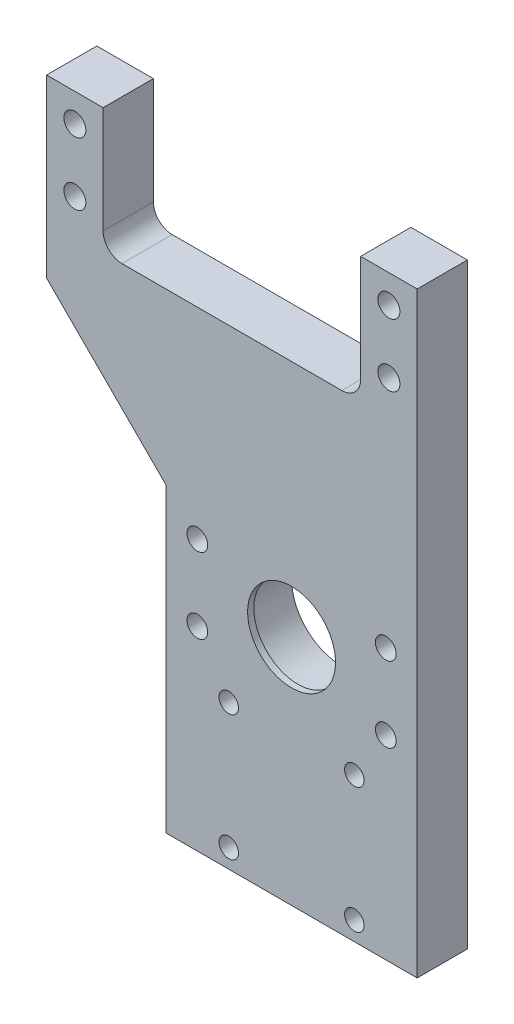
from build123d import *

# Parameters (mm, degrees)
ESQUISSE1_W             = 40
ESQUISSE1_H             = 30
BOSS_EXTRU_1_DEPTH      = 8
ENL_V_START             = -8
ESQUISSE2_R             = 8
ENL_V_MAT_EXTRU_1_DEPTH = 7
ESQUISSE3_W             = 40
ESQUISSE3_H             = 22
BOSS_EXTRU_2_DEPTH      = 8
ESQUISSE4_R             = 1.55
ENL_V_MAT_EXTRU_2_DEPTH = 8
ESQUISSE5_W             = 40
ESQUISSE5_H             = 43
BOSS_EXTRU_3_DEPTH      = 8
ESQUISSE6_W             = 31
ESQUISSE6_H             = 20
ENL_V_MAT_EXTRU_3_DEPTH = 8
BOSS_EXTRU_4_DEPTH      = 8
ESQUISSE8_R             = 1.75
ENL_V_MAT_EXTRU_4_DEPTH = 84.624159189
ESQUISSE9_R             = 7
ENL_V_MAT_EXTRU_5_DEPTH = 84.534424042
ESQUISSE10_R            = 1.65
ENL_V_MAT_EXTRU_6_DEPTH = 10
ESQUISSE11_R            = 1.65
ENL_V_MAT_EXTRU_7_DEPTH = 84.624159189
CHANFREIN1_SIZE         = 19
CONG_1_R                = 3


with BuildPart() as part:
    # Esquisse1 → Boss.-Extru.1 (new body)
    with BuildSketch(Plane.XY):
        with Locations((20, 15)):
            Rectangle(ESQUISSE1_W, ESQUISSE1_H)
    extrude(amount=BOSS_EXTRU_1_DEPTH)

    # Esquisse2 → Enlèv. mat.-Extru.1 (cut)
    with BuildSketch(Plane.XY.offset(8).offset(ENL_V_START)):
        with Locations((20, 15)):
            Circle(ESQUISSE2_R)
    extrude(amount=ENL_V_MAT_EXTRU_1_DEPTH, mode=Mode.SUBTRACT)

    # Esquisse3 → Boss.-Extru.2 (add)
    with BuildSketch(Plane.XY.offset(8)):
        with Locations((20, -11)):
            Rectangle(ESQUISSE3_W, ESQUISSE3_H)
    extrude(amount=-BOSS_EXTRU_2_DEPTH)

    # Esquisse4 → Enlèv. mat.-Extru.2 (cut)
    with BuildSketch(Plane.XY.offset(8).offset(ENL_V_START)):
        with Locations((30, -19)):
            Circle(ESQUISSE4_R)
        with Locations(Location((30, 1, 0), (0, 0, 180))):
            Circle(ESQUISSE4_R)
        with Locations((10, 1)):
            Circle(ESQUISSE4_R)
        with Locations(Location((10, -19, 0), (0, 0, 180))):
            Circle(ESQUISSE4_R)
    extrude(amount=ENL_V_MAT_EXTRU_2_DEPTH, mode=Mode.SUBTRACT)

    # Esquisse5 → Boss.-Extru.3 (add)
    with BuildSketch(Plane.XY.offset(8)):
        with Locations((20, 51.5)):
            Rectangle(ESQUISSE5_W, ESQUISSE5_H)
    extrude(amount=-BOSS_EXTRU_3_DEPTH)

    # Esquisse6 → Enlèv. mat.-Extru.3 (cut)
    with BuildSketch(Plane.XY.offset(8).offset(ENL_V_START)):
        with Locations((15.5, 63)):
            Rectangle(ESQUISSE6_W, ESQUISSE6_H)
    extrude(amount=ENL_V_MAT_EXTRU_3_DEPTH, mode=Mode.SUBTRACT)

    # Esquisse7 → Boss.-Extru.4 (add)
    with BuildSketch(Plane.XY.offset(8)):
        Polygon((0, 53), (-10, 53), (-10, 73), (-19, 73), (-19, 45), (0, 45), align=None)
    extrude(amount=-BOSS_EXTRU_4_DEPTH)

    # Esquisse8 → Enlèv. mat.-Extru.4 (cut, through all)
    with BuildSketch(Plane.XY.offset(8)):
        with Locations((35.5, 58.5)):
            Circle(ESQUISSE8_R)
        with Locations(Location((35.5, 68.5, 0), (0, 0, 180))):
            Circle(ESQUISSE8_R)
        with Locations((-14.5, 68.5)):
            Circle(ESQUISSE8_R)
        with Locations(Location((-14.5, 58.5, 0), (0, 0, 180))):
            Circle(ESQUISSE8_R)
    extrude(amount=-ENL_V_MAT_EXTRU_4_DEPTH, mode=Mode.SUBTRACT)

    # Esquisse9 → Enlèv. mat.-Extru.5 (cut, through all)
    with BuildSketch(Plane(origin=(0, 0, 7), x_dir=(-1, 0, 0), z_dir=(0, 0, -1))):
        with Locations((-20, 15)):
            Circle(ESQUISSE9_R)
    extrude(amount=-ENL_V_MAT_EXTRU_5_DEPTH, mode=Mode.SUBTRACT)

    # Esquisse10 → Enlèv. mat.-Extru.6 (cut)
    with BuildSketch(Plane(origin=(0, -22, 0), x_dir=(-1, 0, 0), z_dir=(0, -1, 0))):
        with Locations(Location((-20, -4, 0), (0, 0, 90))):
            Circle(ESQUISSE10_R)
        with Locations(Location((-36, -4, 0), (0, 0, 90))):
            Circle(ESQUISSE10_R)
    extrude(amount=-ENL_V_MAT_EXTRU_6_DEPTH, mode=Mode.SUBTRACT)

    # Esquisse11 → Enlèv. mat.-Extru.7 (cut, through all)
    with BuildSketch(Plane(origin=(0, 0, 0), x_dir=(-1, 0, 0), z_dir=(0, 0, -1))):
        with Locations((-35, 21)):
            Circle(ESQUISSE11_R)
        with Locations(Location((-5, 21, 0), (0, 0, 180))):
            Circle(ESQUISSE11_R)
        with Locations((-5, 9)):
            Circle(ESQUISSE11_R)
        with Locations(Location((-35, 9, 0), (0, 0, 180))):
            Circle(ESQUISSE11_R)
    extrude(amount=-ENL_V_MAT_EXTRU_7_DEPTH, mode=Mode.SUBTRACT)

    # Chanfrein1
    chanfrein1_edges = [part.edges().sort_by_distance(p)[0] for p in [
        (0, 45, 4),
    ]]
    chamfer(chanfrein1_edges, length=CHANFREIN1_SIZE - 0.0001)  # a hair under: the kernel refuses the full size

    # Congé1
    cong_1_edges = [part.edges().sort_by_distance(p)[0] for p in [
        (31, 53, 4),
        (-10, 53, 4),
    ]]
    fillet(cong_1_edges, radius=CONG_1_R)


solid = part.part
